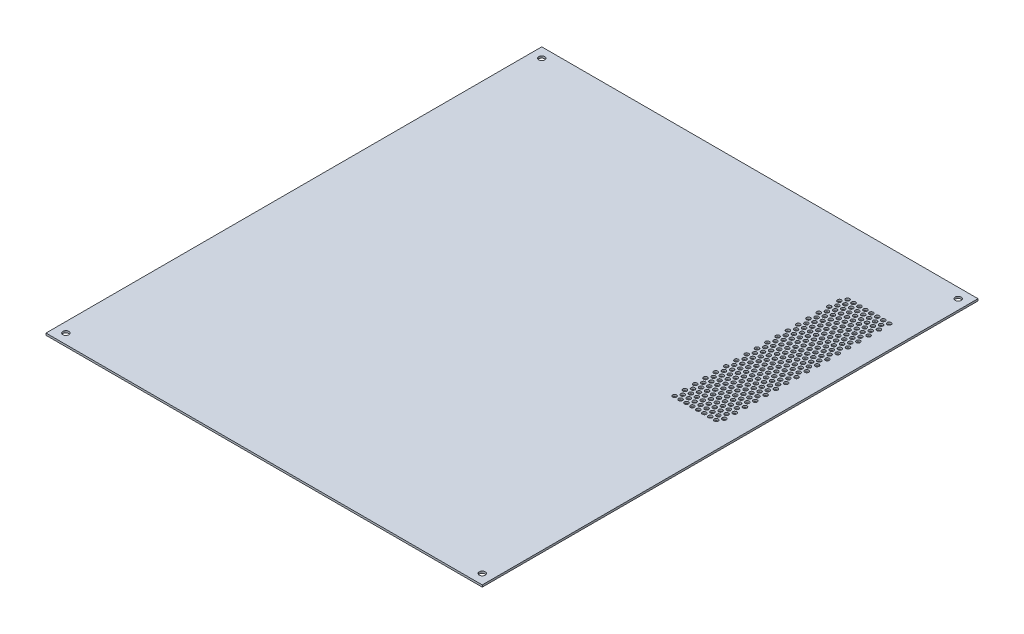
from build123d import *

# Parameters (mm, degrees)
SKETCH1_W           = 440
SKETCH1_H           = 500
SKETCH1_R           = 2
SKETCH1_R_2         = 3
BOSS_EXTRUDE1_DEPTH = 2


with BuildPart() as part:
    # Sketch1 → Boss-Extrude1 (new body)
    with BuildSketch(Plane(origin=(0, 0, 0), x_dir=(1, 0, 0), z_dir=(0, 1, 0))):
        with Locations((220, 250)):
            Rectangle(SKETCH1_W, SKETCH1_H)
        with Locations((372, 262)):
            Circle(SKETCH1_R, mode=Mode.SUBTRACT)
        with Locations((375, 267.196152423)):
            Circle(SKETCH1_R, mode=Mode.SUBTRACT)
        with Locations((381, 267.196152423)):
            Circle(SKETCH1_R, mode=Mode.SUBTRACT)
        with Locations((378, 262)):
            Circle(SKETCH1_R, mode=Mode.SUBTRACT)
        with Locations((387, 267.196152423)):
            Circle(SKETCH1_R, mode=Mode.SUBTRACT)
        with Locations((384, 262)):
            Circle(SKETCH1_R, mode=Mode.SUBTRACT)
        with Locations((393, 267.196152423)):
            Circle(SKETCH1_R, mode=Mode.SUBTRACT)
        with Locations((390, 262)):
            Circle(SKETCH1_R, mode=Mode.SUBTRACT)
        with Locations((399, 267.196152423)):
            Circle(SKETCH1_R, mode=Mode.SUBTRACT)
        with Locations((396, 262)):
            Circle(SKETCH1_R, mode=Mode.SUBTRACT)
        with Locations((405, 267.196152423)):
            Circle(SKETCH1_R, mode=Mode.SUBTRACT)
        with Locations((402, 262)):
            Circle(SKETCH1_R, mode=Mode.SUBTRACT)
        with Locations((411, 267.196152423)):
            Circle(SKETCH1_R, mode=Mode.SUBTRACT)
        with Locations((408, 262)):
            Circle(SKETCH1_R, mode=Mode.SUBTRACT)
        with Locations((417, 267.196152423)):
            Circle(SKETCH1_R, mode=Mode.SUBTRACT)
        with Locations((414, 262)):
            Circle(SKETCH1_R, mode=Mode.SUBTRACT)
        with Locations((381, 277.586152423)):
            Circle(SKETCH1_R, mode=Mode.SUBTRACT)
        with Locations((378, 272.39)):
            Circle(SKETCH1_R, mode=Mode.SUBTRACT)
        with Locations((387, 277.586152423)):
            Circle(SKETCH1_R, mode=Mode.SUBTRACT)
        with Locations((384, 272.39)):
            Circle(SKETCH1_R, mode=Mode.SUBTRACT)
        with Locations((393, 277.586152423)):
            Circle(SKETCH1_R, mode=Mode.SUBTRACT)
        with Locations((390, 272.39)):
            Circle(SKETCH1_R, mode=Mode.SUBTRACT)
        with Locations((399, 277.586152423)):
            Circle(SKETCH1_R, mode=Mode.SUBTRACT)
        with Locations((396, 272.39)):
            Circle(SKETCH1_R, mode=Mode.SUBTRACT)
        with Locations((405, 277.586152423)):
            Circle(SKETCH1_R, mode=Mode.SUBTRACT)
        with Locations((402, 272.39)):
            Circle(SKETCH1_R, mode=Mode.SUBTRACT)
        with Locations((411, 277.586152423)):
            Circle(SKETCH1_R, mode=Mode.SUBTRACT)
        with Locations((408, 272.39)):
            Circle(SKETCH1_R, mode=Mode.SUBTRACT)
        with Locations((417, 277.586152423)):
            Circle(SKETCH1_R, mode=Mode.SUBTRACT)
        with Locations((414, 272.39)):
            Circle(SKETCH1_R, mode=Mode.SUBTRACT)
        with Locations((381, 287.976152423)):
            Circle(SKETCH1_R, mode=Mode.SUBTRACT)
        with Locations((378, 282.78)):
            Circle(SKETCH1_R, mode=Mode.SUBTRACT)
        with Locations((387, 287.976152423)):
            Circle(SKETCH1_R, mode=Mode.SUBTRACT)
        with Locations((384, 282.78)):
            Circle(SKETCH1_R, mode=Mode.SUBTRACT)
        with Locations((393, 287.976152423)):
            Circle(SKETCH1_R, mode=Mode.SUBTRACT)
        with Locations((390, 282.78)):
            Circle(SKETCH1_R, mode=Mode.SUBTRACT)
        with Locations((399, 287.976152423)):
            Circle(SKETCH1_R, mode=Mode.SUBTRACT)
        with Locations((396, 282.78)):
            Circle(SKETCH1_R, mode=Mode.SUBTRACT)
        with Locations((405, 287.976152423)):
            Circle(SKETCH1_R, mode=Mode.SUBTRACT)
        with Locations((402, 282.78)):
            Circle(SKETCH1_R, mode=Mode.SUBTRACT)
        with Locations((411, 287.976152423)):
            Circle(SKETCH1_R, mode=Mode.SUBTRACT)
        with Locations((408, 282.78)):
            Circle(SKETCH1_R, mode=Mode.SUBTRACT)
        with Locations((417, 287.976152423)):
            Circle(SKETCH1_R, mode=Mode.SUBTRACT)
        with Locations((414, 282.78)):
            Circle(SKETCH1_R, mode=Mode.SUBTRACT)
        with Locations((381, 298.366152423)):
            Circle(SKETCH1_R, mode=Mode.SUBTRACT)
        with Locations((378, 293.17)):
            Circle(SKETCH1_R, mode=Mode.SUBTRACT)
        with Locations((387, 298.366152423)):
            Circle(SKETCH1_R, mode=Mode.SUBTRACT)
        with Locations((384, 293.17)):
            Circle(SKETCH1_R, mode=Mode.SUBTRACT)
        with Locations((393, 298.366152423)):
            Circle(SKETCH1_R, mode=Mode.SUBTRACT)
        with Locations((390, 293.17)):
            Circle(SKETCH1_R, mode=Mode.SUBTRACT)
        with Locations((399, 298.366152423)):
            Circle(SKETCH1_R, mode=Mode.SUBTRACT)
        with Locations((396, 293.17)):
            Circle(SKETCH1_R, mode=Mode.SUBTRACT)
        with Locations((405, 298.366152423)):
            Circle(SKETCH1_R, mode=Mode.SUBTRACT)
        with Locations((402, 293.17)):
            Circle(SKETCH1_R, mode=Mode.SUBTRACT)
        with Locations((411, 298.366152423)):
            Circle(SKETCH1_R, mode=Mode.SUBTRACT)
        with Locations((408, 293.17)):
            Circle(SKETCH1_R, mode=Mode.SUBTRACT)
        with Locations((417, 298.366152423)):
            Circle(SKETCH1_R, mode=Mode.SUBTRACT)
        with Locations((414, 293.17)):
            Circle(SKETCH1_R, mode=Mode.SUBTRACT)
        with Locations((381, 308.756152423)):
            Circle(SKETCH1_R, mode=Mode.SUBTRACT)
        with Locations((378, 303.56)):
            Circle(SKETCH1_R, mode=Mode.SUBTRACT)
        with Locations((387, 308.756152423)):
            Circle(SKETCH1_R, mode=Mode.SUBTRACT)
        with Locations((384, 303.56)):
            Circle(SKETCH1_R, mode=Mode.SUBTRACT)
        with Locations((393, 308.756152423)):
            Circle(SKETCH1_R, mode=Mode.SUBTRACT)
        with Locations((390, 303.56)):
            Circle(SKETCH1_R, mode=Mode.SUBTRACT)
        with Locations((399, 308.756152423)):
            Circle(SKETCH1_R, mode=Mode.SUBTRACT)
        with Locations((396, 303.56)):
            Circle(SKETCH1_R, mode=Mode.SUBTRACT)
        with Locations((405, 308.756152423)):
            Circle(SKETCH1_R, mode=Mode.SUBTRACT)
        with Locations((402, 303.56)):
            Circle(SKETCH1_R, mode=Mode.SUBTRACT)
        with Locations((411, 308.756152423)):
            Circle(SKETCH1_R, mode=Mode.SUBTRACT)
        with Locations((408, 303.56)):
            Circle(SKETCH1_R, mode=Mode.SUBTRACT)
        with Locations((417, 308.756152423)):
            Circle(SKETCH1_R, mode=Mode.SUBTRACT)
        with Locations((414, 303.56)):
            Circle(SKETCH1_R, mode=Mode.SUBTRACT)
        with Locations((381, 319.146152423)):
            Circle(SKETCH1_R, mode=Mode.SUBTRACT)
        with Locations((378, 313.95)):
            Circle(SKETCH1_R, mode=Mode.SUBTRACT)
        with Locations((387, 319.146152423)):
            Circle(SKETCH1_R, mode=Mode.SUBTRACT)
        with Locations((384, 313.95)):
            Circle(SKETCH1_R, mode=Mode.SUBTRACT)
        with Locations((393, 319.146152423)):
            Circle(SKETCH1_R, mode=Mode.SUBTRACT)
        with Locations((390, 313.95)):
            Circle(SKETCH1_R, mode=Mode.SUBTRACT)
        with Locations((399, 319.146152423)):
            Circle(SKETCH1_R, mode=Mode.SUBTRACT)
        with Locations((396, 313.95)):
            Circle(SKETCH1_R, mode=Mode.SUBTRACT)
        with Locations((405, 319.146152423)):
            Circle(SKETCH1_R, mode=Mode.SUBTRACT)
        with Locations((402, 313.95)):
            Circle(SKETCH1_R, mode=Mode.SUBTRACT)
        with Locations((411, 319.146152423)):
            Circle(SKETCH1_R, mode=Mode.SUBTRACT)
        with Locations((408, 313.95)):
            Circle(SKETCH1_R, mode=Mode.SUBTRACT)
        with Locations((417, 319.146152423)):
            Circle(SKETCH1_R, mode=Mode.SUBTRACT)
        with Locations((414, 313.95)):
            Circle(SKETCH1_R, mode=Mode.SUBTRACT)
        with Locations((381, 329.536152423)):
            Circle(SKETCH1_R, mode=Mode.SUBTRACT)
        with Locations((378, 324.34)):
            Circle(SKETCH1_R, mode=Mode.SUBTRACT)
        with Locations((387, 329.536152423)):
            Circle(SKETCH1_R, mode=Mode.SUBTRACT)
        with Locations((384, 324.34)):
            Circle(SKETCH1_R, mode=Mode.SUBTRACT)
        with Locations((393, 329.536152423)):
            Circle(SKETCH1_R, mode=Mode.SUBTRACT)
        with Locations((390, 324.34)):
            Circle(SKETCH1_R, mode=Mode.SUBTRACT)
        with Locations((399, 329.536152423)):
            Circle(SKETCH1_R, mode=Mode.SUBTRACT)
        with Locations((396, 324.34)):
            Circle(SKETCH1_R, mode=Mode.SUBTRACT)
        with Locations((405, 329.536152423)):
            Circle(SKETCH1_R, mode=Mode.SUBTRACT)
        with Locations((402, 324.34)):
            Circle(SKETCH1_R, mode=Mode.SUBTRACT)
        with Locations((411, 329.536152423)):
            Circle(SKETCH1_R, mode=Mode.SUBTRACT)
        with Locations((408, 324.34)):
            Circle(SKETCH1_R, mode=Mode.SUBTRACT)
        with Locations((417, 329.536152423)):
            Circle(SKETCH1_R, mode=Mode.SUBTRACT)
        with Locations((414, 324.34)):
            Circle(SKETCH1_R, mode=Mode.SUBTRACT)
        with Locations((381, 339.926152423)):
            Circle(SKETCH1_R, mode=Mode.SUBTRACT)
        with Locations((378, 334.73)):
            Circle(SKETCH1_R, mode=Mode.SUBTRACT)
        with Locations((387, 339.926152423)):
            Circle(SKETCH1_R, mode=Mode.SUBTRACT)
        with Locations((384, 334.73)):
            Circle(SKETCH1_R, mode=Mode.SUBTRACT)
        with Locations((393, 339.926152423)):
            Circle(SKETCH1_R, mode=Mode.SUBTRACT)
        with Locations((390, 334.73)):
            Circle(SKETCH1_R, mode=Mode.SUBTRACT)
        with Locations((399, 339.926152423)):
            Circle(SKETCH1_R, mode=Mode.SUBTRACT)
        with Locations((396, 334.73)):
            Circle(SKETCH1_R, mode=Mode.SUBTRACT)
        with Locations((405, 339.926152423)):
            Circle(SKETCH1_R, mode=Mode.SUBTRACT)
        with Locations((402, 334.73)):
            Circle(SKETCH1_R, mode=Mode.SUBTRACT)
        with Locations((411, 339.926152423)):
            Circle(SKETCH1_R, mode=Mode.SUBTRACT)
        with Locations((408, 334.73)):
            Circle(SKETCH1_R, mode=Mode.SUBTRACT)
        with Locations((417, 339.926152423)):
            Circle(SKETCH1_R, mode=Mode.SUBTRACT)
        with Locations((414, 334.73)):
            Circle(SKETCH1_R, mode=Mode.SUBTRACT)
        with Locations((381, 350.316152423)):
            Circle(SKETCH1_R, mode=Mode.SUBTRACT)
        with Locations((378, 345.12)):
            Circle(SKETCH1_R, mode=Mode.SUBTRACT)
        with Locations((387, 350.316152423)):
            Circle(SKETCH1_R, mode=Mode.SUBTRACT)
        with Locations((384, 345.12)):
            Circle(SKETCH1_R, mode=Mode.SUBTRACT)
        with Locations((393, 350.316152423)):
            Circle(SKETCH1_R, mode=Mode.SUBTRACT)
        with Locations((390, 345.12)):
            Circle(SKETCH1_R, mode=Mode.SUBTRACT)
        with Locations((399, 350.316152423)):
            Circle(SKETCH1_R, mode=Mode.SUBTRACT)
        with Locations((396, 345.12)):
            Circle(SKETCH1_R, mode=Mode.SUBTRACT)
        with Locations((405, 350.316152423)):
            Circle(SKETCH1_R, mode=Mode.SUBTRACT)
        with Locations((402, 345.12)):
            Circle(SKETCH1_R, mode=Mode.SUBTRACT)
        with Locations((411, 350.316152423)):
            Circle(SKETCH1_R, mode=Mode.SUBTRACT)
        with Locations((408, 345.12)):
            Circle(SKETCH1_R, mode=Mode.SUBTRACT)
        with Locations((417, 350.316152423)):
            Circle(SKETCH1_R, mode=Mode.SUBTRACT)
        with Locations((414, 345.12)):
            Circle(SKETCH1_R, mode=Mode.SUBTRACT)
        with Locations((381, 360.706152423)):
            Circle(SKETCH1_R, mode=Mode.SUBTRACT)
        with Locations((378, 355.51)):
            Circle(SKETCH1_R, mode=Mode.SUBTRACT)
        with Locations((387, 360.706152423)):
            Circle(SKETCH1_R, mode=Mode.SUBTRACT)
        with Locations((384, 355.51)):
            Circle(SKETCH1_R, mode=Mode.SUBTRACT)
        with Locations((393, 360.706152423)):
            Circle(SKETCH1_R, mode=Mode.SUBTRACT)
        with Locations((390, 355.51)):
            Circle(SKETCH1_R, mode=Mode.SUBTRACT)
        with Locations((399, 360.706152423)):
            Circle(SKETCH1_R, mode=Mode.SUBTRACT)
        with Locations((396, 355.51)):
            Circle(SKETCH1_R, mode=Mode.SUBTRACT)
        with Locations((405, 360.706152423)):
            Circle(SKETCH1_R, mode=Mode.SUBTRACT)
        with Locations((402, 355.51)):
            Circle(SKETCH1_R, mode=Mode.SUBTRACT)
        with Locations((411, 360.706152423)):
            Circle(SKETCH1_R, mode=Mode.SUBTRACT)
        with Locations((408, 355.51)):
            Circle(SKETCH1_R, mode=Mode.SUBTRACT)
        with Locations((417, 360.706152423)):
            Circle(SKETCH1_R, mode=Mode.SUBTRACT)
        with Locations((414, 355.51)):
            Circle(SKETCH1_R, mode=Mode.SUBTRACT)
        with Locations((381, 371.096152423)):
            Circle(SKETCH1_R, mode=Mode.SUBTRACT)
        with Locations((378, 365.9)):
            Circle(SKETCH1_R, mode=Mode.SUBTRACT)
        with Locations((387, 371.096152423)):
            Circle(SKETCH1_R, mode=Mode.SUBTRACT)
        with Locations((384, 365.9)):
            Circle(SKETCH1_R, mode=Mode.SUBTRACT)
        with Locations((393, 371.096152423)):
            Circle(SKETCH1_R, mode=Mode.SUBTRACT)
        with Locations((390, 365.9)):
            Circle(SKETCH1_R, mode=Mode.SUBTRACT)
        with Locations((399, 371.096152423)):
            Circle(SKETCH1_R, mode=Mode.SUBTRACT)
        with Locations((396, 365.9)):
            Circle(SKETCH1_R, mode=Mode.SUBTRACT)
        with Locations((405, 371.096152423)):
            Circle(SKETCH1_R, mode=Mode.SUBTRACT)
        with Locations((402, 365.9)):
            Circle(SKETCH1_R, mode=Mode.SUBTRACT)
        with Locations((411, 371.096152423)):
            Circle(SKETCH1_R, mode=Mode.SUBTRACT)
        with Locations((408, 365.9)):
            Circle(SKETCH1_R, mode=Mode.SUBTRACT)
        with Locations((417, 371.096152423)):
            Circle(SKETCH1_R, mode=Mode.SUBTRACT)
        with Locations((414, 365.9)):
            Circle(SKETCH1_R, mode=Mode.SUBTRACT)
        with Locations((381, 381.486152423)):
            Circle(SKETCH1_R, mode=Mode.SUBTRACT)
        with Locations((378, 376.29)):
            Circle(SKETCH1_R, mode=Mode.SUBTRACT)
        with Locations((387, 381.486152423)):
            Circle(SKETCH1_R, mode=Mode.SUBTRACT)
        with Locations((384, 376.29)):
            Circle(SKETCH1_R, mode=Mode.SUBTRACT)
        with Locations((393, 381.486152423)):
            Circle(SKETCH1_R, mode=Mode.SUBTRACT)
        with Locations((390, 376.29)):
            Circle(SKETCH1_R, mode=Mode.SUBTRACT)
        with Locations((399, 381.486152423)):
            Circle(SKETCH1_R, mode=Mode.SUBTRACT)
        with Locations((396, 376.29)):
            Circle(SKETCH1_R, mode=Mode.SUBTRACT)
        with Locations((405, 381.486152423)):
            Circle(SKETCH1_R, mode=Mode.SUBTRACT)
        with Locations((402, 376.29)):
            Circle(SKETCH1_R, mode=Mode.SUBTRACT)
        with Locations((411, 381.486152423)):
            Circle(SKETCH1_R, mode=Mode.SUBTRACT)
        with Locations((408, 376.29)):
            Circle(SKETCH1_R, mode=Mode.SUBTRACT)
        with Locations((417, 381.486152423)):
            Circle(SKETCH1_R, mode=Mode.SUBTRACT)
        with Locations((414, 376.29)):
            Circle(SKETCH1_R, mode=Mode.SUBTRACT)
        with Locations((381, 391.876152423)):
            Circle(SKETCH1_R, mode=Mode.SUBTRACT)
        with Locations((378, 386.68)):
            Circle(SKETCH1_R, mode=Mode.SUBTRACT)
        with Locations((387, 391.876152423)):
            Circle(SKETCH1_R, mode=Mode.SUBTRACT)
        with Locations((384, 386.68)):
            Circle(SKETCH1_R, mode=Mode.SUBTRACT)
        with Locations((393, 391.876152423)):
            Circle(SKETCH1_R, mode=Mode.SUBTRACT)
        with Locations((390, 386.68)):
            Circle(SKETCH1_R, mode=Mode.SUBTRACT)
        with Locations((399, 391.876152423)):
            Circle(SKETCH1_R, mode=Mode.SUBTRACT)
        with Locations((396, 386.68)):
            Circle(SKETCH1_R, mode=Mode.SUBTRACT)
        with Locations((405, 391.876152423)):
            Circle(SKETCH1_R, mode=Mode.SUBTRACT)
        with Locations((402, 386.68)):
            Circle(SKETCH1_R, mode=Mode.SUBTRACT)
        with Locations((411, 391.876152423)):
            Circle(SKETCH1_R, mode=Mode.SUBTRACT)
        with Locations((408, 386.68)):
            Circle(SKETCH1_R, mode=Mode.SUBTRACT)
        with Locations((417, 391.876152423)):
            Circle(SKETCH1_R, mode=Mode.SUBTRACT)
        with Locations((414, 386.68)):
            Circle(SKETCH1_R, mode=Mode.SUBTRACT)
        with Locations((381, 402.266152423)):
            Circle(SKETCH1_R, mode=Mode.SUBTRACT)
        with Locations((378, 397.07)):
            Circle(SKETCH1_R, mode=Mode.SUBTRACT)
        with Locations((387, 402.266152423)):
            Circle(SKETCH1_R, mode=Mode.SUBTRACT)
        with Locations((384, 397.07)):
            Circle(SKETCH1_R, mode=Mode.SUBTRACT)
        with Locations((393, 402.266152423)):
            Circle(SKETCH1_R, mode=Mode.SUBTRACT)
        with Locations((390, 397.07)):
            Circle(SKETCH1_R, mode=Mode.SUBTRACT)
        with Locations((399, 402.266152423)):
            Circle(SKETCH1_R, mode=Mode.SUBTRACT)
        with Locations((396, 397.07)):
            Circle(SKETCH1_R, mode=Mode.SUBTRACT)
        with Locations((405, 402.266152423)):
            Circle(SKETCH1_R, mode=Mode.SUBTRACT)
        with Locations((402, 397.07)):
            Circle(SKETCH1_R, mode=Mode.SUBTRACT)
        with Locations((411, 402.266152423)):
            Circle(SKETCH1_R, mode=Mode.SUBTRACT)
        with Locations((408, 397.07)):
            Circle(SKETCH1_R, mode=Mode.SUBTRACT)
        with Locations((417, 402.266152423)):
            Circle(SKETCH1_R, mode=Mode.SUBTRACT)
        with Locations((414, 397.07)):
            Circle(SKETCH1_R, mode=Mode.SUBTRACT)
        with Locations((381, 412.656152423)):
            Circle(SKETCH1_R, mode=Mode.SUBTRACT)
        with Locations((378, 407.46)):
            Circle(SKETCH1_R, mode=Mode.SUBTRACT)
        with Locations((387, 412.656152423)):
            Circle(SKETCH1_R, mode=Mode.SUBTRACT)
        with Locations((384, 407.46)):
            Circle(SKETCH1_R, mode=Mode.SUBTRACT)
        with Locations((393, 412.656152423)):
            Circle(SKETCH1_R, mode=Mode.SUBTRACT)
        with Locations((390, 407.46)):
            Circle(SKETCH1_R, mode=Mode.SUBTRACT)
        with Locations((399, 412.656152423)):
            Circle(SKETCH1_R, mode=Mode.SUBTRACT)
        with Locations((396, 407.46)):
            Circle(SKETCH1_R, mode=Mode.SUBTRACT)
        with Locations((405, 412.656152423)):
            Circle(SKETCH1_R, mode=Mode.SUBTRACT)
        with Locations((402, 407.46)):
            Circle(SKETCH1_R, mode=Mode.SUBTRACT)
        with Locations((411, 412.656152423)):
            Circle(SKETCH1_R, mode=Mode.SUBTRACT)
        with Locations((408, 407.46)):
            Circle(SKETCH1_R, mode=Mode.SUBTRACT)
        with Locations((417, 412.656152423)):
            Circle(SKETCH1_R, mode=Mode.SUBTRACT)
        with Locations((414, 407.46)):
            Circle(SKETCH1_R, mode=Mode.SUBTRACT)
        with Locations((381, 423.046152423)):
            Circle(SKETCH1_R, mode=Mode.SUBTRACT)
        with Locations((378, 417.85)):
            Circle(SKETCH1_R, mode=Mode.SUBTRACT)
        with Locations((387, 423.046152423)):
            Circle(SKETCH1_R, mode=Mode.SUBTRACT)
        with Locations((384, 417.85)):
            Circle(SKETCH1_R, mode=Mode.SUBTRACT)
        with Locations((393, 423.046152423)):
            Circle(SKETCH1_R, mode=Mode.SUBTRACT)
        with Locations((390, 417.85)):
            Circle(SKETCH1_R, mode=Mode.SUBTRACT)
        with Locations((399, 423.046152423)):
            Circle(SKETCH1_R, mode=Mode.SUBTRACT)
        with Locations((396, 417.85)):
            Circle(SKETCH1_R, mode=Mode.SUBTRACT)
        with Locations((405, 423.046152423)):
            Circle(SKETCH1_R, mode=Mode.SUBTRACT)
        with Locations((402, 417.85)):
            Circle(SKETCH1_R, mode=Mode.SUBTRACT)
        with Locations((411, 423.046152423)):
            Circle(SKETCH1_R, mode=Mode.SUBTRACT)
        with Locations((408, 417.85)):
            Circle(SKETCH1_R, mode=Mode.SUBTRACT)
        with Locations((417, 423.046152423)):
            Circle(SKETCH1_R, mode=Mode.SUBTRACT)
        with Locations((414, 417.85)):
            Circle(SKETCH1_R, mode=Mode.SUBTRACT)
        with Locations((381, 433.436152423)):
            Circle(SKETCH1_R, mode=Mode.SUBTRACT)
        with Locations((378, 428.24)):
            Circle(SKETCH1_R, mode=Mode.SUBTRACT)
        with Locations((387, 433.436152423)):
            Circle(SKETCH1_R, mode=Mode.SUBTRACT)
        with Locations((384, 428.24)):
            Circle(SKETCH1_R, mode=Mode.SUBTRACT)
        with Locations((393, 433.436152423)):
            Circle(SKETCH1_R, mode=Mode.SUBTRACT)
        with Locations((390, 428.24)):
            Circle(SKETCH1_R, mode=Mode.SUBTRACT)
        with Locations((399, 433.436152423)):
            Circle(SKETCH1_R, mode=Mode.SUBTRACT)
        with Locations((396, 428.24)):
            Circle(SKETCH1_R, mode=Mode.SUBTRACT)
        with Locations((405, 433.436152423)):
            Circle(SKETCH1_R, mode=Mode.SUBTRACT)
        with Locations((402, 428.24)):
            Circle(SKETCH1_R, mode=Mode.SUBTRACT)
        with Locations((411, 433.436152423)):
            Circle(SKETCH1_R, mode=Mode.SUBTRACT)
        with Locations((408, 428.24)):
            Circle(SKETCH1_R, mode=Mode.SUBTRACT)
        with Locations((417, 433.436152423)):
            Circle(SKETCH1_R, mode=Mode.SUBTRACT)
        with Locations((414, 428.24)):
            Circle(SKETCH1_R, mode=Mode.SUBTRACT)
        with Locations((375, 277.586152423)):
            Circle(SKETCH1_R, mode=Mode.SUBTRACT)
        with Locations((372, 272.39)):
            Circle(SKETCH1_R, mode=Mode.SUBTRACT)
        with Locations((375, 287.976152423)):
            Circle(SKETCH1_R, mode=Mode.SUBTRACT)
        with Locations((372, 282.78)):
            Circle(SKETCH1_R, mode=Mode.SUBTRACT)
        with Locations((375, 298.366152423)):
            Circle(SKETCH1_R, mode=Mode.SUBTRACT)
        with Locations((372, 293.17)):
            Circle(SKETCH1_R, mode=Mode.SUBTRACT)
        with Locations((375, 308.756152423)):
            Circle(SKETCH1_R, mode=Mode.SUBTRACT)
        with Locations((372, 303.56)):
            Circle(SKETCH1_R, mode=Mode.SUBTRACT)
        with Locations((375, 319.146152423)):
            Circle(SKETCH1_R, mode=Mode.SUBTRACT)
        with Locations((372, 313.95)):
            Circle(SKETCH1_R, mode=Mode.SUBTRACT)
        with Locations((375, 329.536152423)):
            Circle(SKETCH1_R, mode=Mode.SUBTRACT)
        with Locations((372, 324.34)):
            Circle(SKETCH1_R, mode=Mode.SUBTRACT)
        with Locations((375, 339.926152423)):
            Circle(SKETCH1_R, mode=Mode.SUBTRACT)
        with Locations((372, 334.73)):
            Circle(SKETCH1_R, mode=Mode.SUBTRACT)
        with Locations((375, 350.316152423)):
            Circle(SKETCH1_R, mode=Mode.SUBTRACT)
        with Locations((372, 345.12)):
            Circle(SKETCH1_R, mode=Mode.SUBTRACT)
        with Locations((375, 360.706152423)):
            Circle(SKETCH1_R, mode=Mode.SUBTRACT)
        with Locations((372, 355.51)):
            Circle(SKETCH1_R, mode=Mode.SUBTRACT)
        with Locations((375, 371.096152423)):
            Circle(SKETCH1_R, mode=Mode.SUBTRACT)
        with Locations((372, 365.9)):
            Circle(SKETCH1_R, mode=Mode.SUBTRACT)
        with Locations((375, 381.486152423)):
            Circle(SKETCH1_R, mode=Mode.SUBTRACT)
        with Locations((372, 376.29)):
            Circle(SKETCH1_R, mode=Mode.SUBTRACT)
        with Locations((375, 391.876152423)):
            Circle(SKETCH1_R, mode=Mode.SUBTRACT)
        with Locations((372, 386.68)):
            Circle(SKETCH1_R, mode=Mode.SUBTRACT)
        with Locations((375, 402.266152423)):
            Circle(SKETCH1_R, mode=Mode.SUBTRACT)
        with Locations((372, 397.07)):
            Circle(SKETCH1_R, mode=Mode.SUBTRACT)
        with Locations((375, 412.656152423)):
            Circle(SKETCH1_R, mode=Mode.SUBTRACT)
        with Locations((372, 407.46)):
            Circle(SKETCH1_R, mode=Mode.SUBTRACT)
        with Locations((375, 423.046152423)):
            Circle(SKETCH1_R, mode=Mode.SUBTRACT)
        with Locations((372, 417.85)):
            Circle(SKETCH1_R, mode=Mode.SUBTRACT)
        with Locations((375, 433.436152423)):
            Circle(SKETCH1_R, mode=Mode.SUBTRACT)
        with Locations((372, 428.24)):
            Circle(SKETCH1_R, mode=Mode.SUBTRACT)
        with Locations((10, 490)):
            Circle(SKETCH1_R_2, mode=Mode.SUBTRACT)
        with Locations((430, 490)):
            Circle(SKETCH1_R_2, mode=Mode.SUBTRACT)
        with Locations((430, 10)):
            Circle(SKETCH1_R_2, mode=Mode.SUBTRACT)
        with Locations((10, 10)):
            Circle(SKETCH1_R_2, mode=Mode.SUBTRACT)
    extrude(amount=BOSS_EXTRUDE1_DEPTH)


solid = part.part
